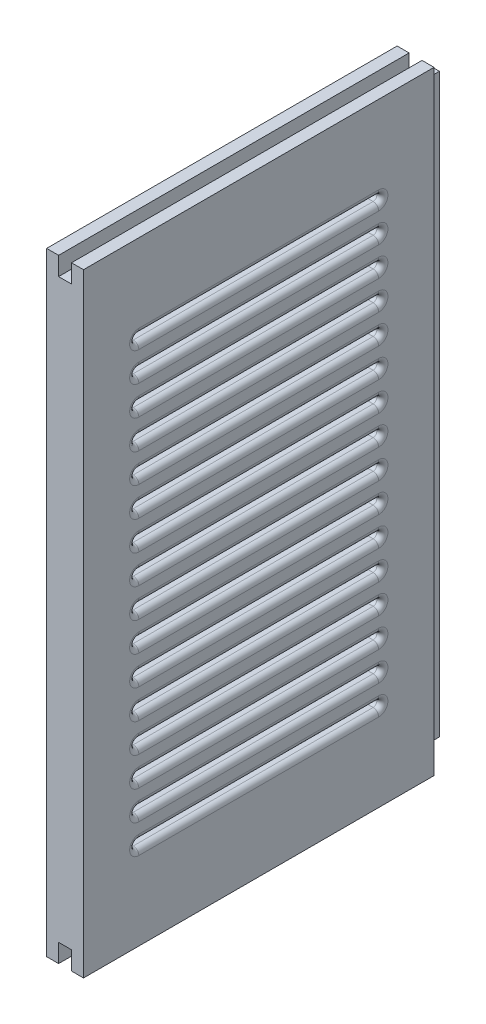
from build123d import *
from OCP.BRepFilletAPI import BRepFilletAPI_MakeChamfer

# Parameters (mm, degrees)
SKETCH1_W              = 166.25
SKETCH1_H              = 95
BOSS_EXTRUDE1_DEPTH    = 10
SKETCH2_W              = 3.3
SKETCH2_H              = 4.8
BOSS_EXTRUDE2_DEPTH    = 166.25
SKETCH3_W              = 3.5
SKETCH3_H              = 99.8
CUT_EXTRUDE1_DEPTH     = 5
SKETCH4_W              = 146.25
SKETCH4_H              = 85
CUT_EXTRUDE2_DEPTH     = 5
CHAMFER1_SIZE          = 2.5
CHAMFER1_SIZE_2        = 5
CUT_EXTRUDE3_REACH     = 193.544
FILLET1_R              = 1.5
LPATTERN1_COUNT        = 16
LPATTERN1_PITCH        = 7.916666667
FILLET1_OF_LPATTERN1_R = 1.5


with BuildPart() as part:
    # Sketch1 → Boss-Extrude1 (new body)
    with BuildSketch(Plane.YZ):
        with Locations((83.125, 47.5)):
            Rectangle(SKETCH1_W, SKETCH1_H)
    extrude(amount=-BOSS_EXTRUDE1_DEPTH)

    # Sketch2 → Boss-Extrude2 (add)
    with BuildSketch(Plane(origin=(0, 166.25, 0), x_dir=(-1, 0, 0), z_dir=(0, 1, 0))):
        with Locations((5, -2.4)):
            Rectangle(SKETCH2_W, SKETCH2_H)
    extrude(amount=-BOSS_EXTRUDE2_DEPTH)

    # Sketch3 → Cut-Extrude1 (cut)
    with BuildSketch(Plane(origin=(0, 166.25, 0), x_dir=(-1, 0, 0), z_dir=(0, 1, 0))):
        with Locations((5, 45.1)):
            Rectangle(SKETCH3_W, SKETCH3_H)
    cut_extrude1 = extrude(amount=-CUT_EXTRUDE1_DEPTH, mode=Mode.SUBTRACT)

    # Mirror1: Cut-Extrude1 across plane
    add(cut_extrude1.mirror(Plane.ZX.offset(83.125)), mode=Mode.SUBTRACT)

    # Sketch4 → Cut-Extrude2 (cut)
    with BuildSketch(Plane(origin=(-10, 0, 0), x_dir=(0, -1, 0), z_dir=(-1, 0, 0))):
        with Locations((-83.125, 47.5)):
            Rectangle(SKETCH4_W, SKETCH4_H)
    extrude(amount=-CUT_EXTRUDE2_DEPTH, mode=Mode.SUBTRACT)

    # Chamfer1
    chamfer1_edges_1 = [part.edges().sort_by_distance(p)[0] for p in [
        (-10, 10, 47.5),
    ]]
    chamfer1_side_1 = [part.faces().sort_by_distance(p)[0] for p in [
        (-10, 9.95, 47.5),
    ]]
    chamfer1_edges_2 = [part.edges().sort_by_distance(p)[0] for p in [
        (-10, 83.125, 5),
    ]]
    chamfer1_side_2 = [part.faces().sort_by_distance(p)[0] for p in [
        (-10, 83.125, 4.95),
    ]]
    chamfer1_edges_3 = [part.edges().sort_by_distance(p)[0] for p in [
        (-10, 156.25, 47.5),
    ]]
    chamfer1_side_3 = [part.faces().sort_by_distance(p)[0] for p in [
        (-10, 156.3, 47.5),
    ]]
    chamfer1_edges_4 = [part.edges().sort_by_distance(p)[0] for p in [
        (-10, 83.125, 90),
    ]]
    chamfer1_side_4 = [part.faces().sort_by_distance(p)[0] for p in [
        (-10, 83.125, 90.05),
    ]]
    chamfer1 = BRepFilletAPI_MakeChamfer(part.part.solid().wrapped)
    for e in chamfer1_edges_1:
        chamfer1.Add(CHAMFER1_SIZE - 0.0001, CHAMFER1_SIZE_2 - 0.0001, e.wrapped, chamfer1_side_1[0].wrapped)
    for e in chamfer1_edges_2:
        chamfer1.Add(CHAMFER1_SIZE - 0.0001, CHAMFER1_SIZE_2 - 0.0001, e.wrapped, chamfer1_side_2[0].wrapped)
    for e in chamfer1_edges_3:
        chamfer1.Add(CHAMFER1_SIZE - 0.0001, CHAMFER1_SIZE_2 - 0.0001, e.wrapped, chamfer1_side_3[0].wrapped)
    for e in chamfer1_edges_4:
        chamfer1.Add(CHAMFER1_SIZE - 0.0001, CHAMFER1_SIZE_2 - 0.0001, e.wrapped, chamfer1_side_4[0].wrapped)
    add(Compound.cast(chamfer1.Shape()), mode=Mode.REPLACE)  # a hair under: the kernel refuses the full size

    # Sketch5 → Cut-Extrude3 (cut, up to next)
    with BuildSketch(Plane(origin=(-5, 0, 0), x_dir=(0, -1, 0), z_dir=(-1, 0, 0)), mode=Mode.PRIVATE) as cut_extrude3_sk1:
        with BuildLine():
            Line((-141.5, 80), (-141.5, 15))
            ThreePointArc((-141.5, 15), (-142.5, 14), (-143.5, 15))
            Line((-143.5, 15), (-143.5, 80))
            ThreePointArc((-143.5, 80), (-142.5, 81), (-141.5, 80))
        make_face()
    cut_extrude3_tool1 = extrude(cut_extrude3_sk1.sketch, amount=-CUT_EXTRUDE3_REACH, mode=Mode.PRIVATE) & part.part
    cut_extrude3 = cut_extrude3_tool1.solids().sort_by_distance((-5, 142.5, 47.5))[0]
    add(cut_extrude3, mode=Mode.SUBTRACT)

    # Fillet1
    fillet1_edges = [part.edges().sort_by_distance(p)[0] for p in [
        (-5, 142.5, 81),
        (-5, 143.5, 47.5),
        (-5, 142.5, 14),
        (-5, 141.5, 47.5),
        (0, 143.5, 47.5),
        (0, 142.5, 81),
        (0, 141.5, 47.5),
        (0, 142.5, 14),
    ]]
    fillet(fillet1_edges, radius=FILLET1_R)

    # LPattern1: Cut-Extrude3 ×16
    with Locations(*[(0, -i * LPATTERN1_PITCH, 0) for i in range(1, LPATTERN1_COUNT)]):
        add(cut_extrude3, mode=Mode.SUBTRACT)

    # Fillet1 of LPattern1
    fillet1_of_lpattern1_edges = [part.edges().sort_by_distance(p)[0] for p in [
        (-5, 134.583333333, 81),
        (-5, 135.583333333, 47.5),
        (-5, 134.583333333, 14),
        (-5, 133.583333333, 47.5),
        (0, 135.583333333, 47.5),
        (0, 134.583333333, 81),
        (0, 133.583333333, 47.5),
        (0, 134.583333333, 14),
        (-5, 126.666666667, 81),
        (-5, 127.666666667, 47.5),
        (-5, 126.666666667, 14),
        (-5, 125.666666667, 47.5),
        (0, 127.666666667, 47.5),
        (0, 126.666666667, 81),
        (0, 125.666666667, 47.5),
        (0, 126.666666667, 14),
        (-5, 118.75, 81),
        (-5, 119.75, 47.5),
        (-5, 118.75, 14),
        (-5, 117.75, 47.5),
        (0, 119.75, 47.5),
        (0, 118.75, 81),
        (0, 117.75, 47.5),
        (0, 118.75, 14),
        (-5, 110.833333333, 81),
        (-5, 111.833333333, 47.5),
        (-5, 110.833333333, 14),
        (-5, 109.833333333, 47.5),
        (0, 111.833333333, 47.5),
        (0, 110.833333333, 81),
        (0, 109.833333333, 47.5),
        (0, 110.833333333, 14),
        (-5, 102.916666667, 81),
        (-5, 103.916666667, 47.5),
        (-5, 102.916666667, 14),
        (-5, 101.916666667, 47.5),
        (0, 103.916666667, 47.5),
        (0, 102.916666667, 81),
        (0, 101.916666667, 47.5),
        (0, 102.916666667, 14),
        (-5, 95, 81),
        (-5, 96, 47.5),
        (-5, 95, 14),
        (-5, 94, 47.5),
        (0, 96, 47.5),
        (0, 95, 81),
        (0, 94, 47.5),
        (0, 95, 14),
        (-5, 87.083333333, 81),
        (-5, 88.083333333, 47.5),
        (-5, 87.083333333, 14),
        (-5, 86.083333333, 47.5),
        (0, 88.083333333, 47.5),
        (0, 87.083333333, 81),
        (0, 86.083333333, 47.5),
        (0, 87.083333333, 14),
        (-5, 79.166666667, 81),
        (-5, 80.166666667, 47.5),
        (-5, 79.166666667, 14),
        (-5, 78.166666667, 47.5),
        (0, 80.166666667, 47.5),
        (0, 79.166666667, 81),
        (0, 78.166666667, 47.5),
        (0, 79.166666667, 14),
        (-5, 71.25, 81),
        (-5, 72.25, 47.5),
        (-5, 71.25, 14),
        (-5, 70.25, 47.5),
        (0, 72.25, 47.5),
        (0, 71.25, 81),
        (0, 70.25, 47.5),
        (0, 71.25, 14),
        (-5, 63.333333333, 81),
        (-5, 64.333333333, 47.5),
        (-5, 63.333333333, 14),
        (-5, 62.333333333, 47.5),
        (0, 64.333333333, 47.5),
        (0, 63.333333333, 81),
        (0, 62.333333333, 47.5),
        (0, 63.333333333, 14),
        (-5, 55.416666667, 81),
        (-5, 56.416666667, 47.5),
        (-5, 55.416666667, 14),
        (-5, 54.416666667, 47.5),
        (0, 56.416666667, 47.5),
        (0, 55.416666667, 81),
        (0, 54.416666667, 47.5),
        (0, 55.416666667, 14),
        (-5, 47.5, 81),
        (-5, 48.5, 47.5),
        (-5, 47.5, 14),
        (-5, 46.5, 47.5),
        (0, 48.5, 47.5),
        (0, 47.5, 81),
        (0, 46.5, 47.5),
        (0, 47.5, 14),
        (-5, 39.583333333, 81),
        (-5, 40.583333333, 47.5),
        (-5, 39.583333333, 14),
        (-5, 38.583333333, 47.5),
        (0, 40.583333333, 47.5),
        (0, 39.583333333, 81),
        (0, 38.583333333, 47.5),
        (0, 39.583333333, 14),
        (-5, 31.666666667, 81),
        (-5, 32.666666667, 47.5),
        (-5, 31.666666667, 14),
        (-5, 30.666666667, 47.5),
        (0, 32.666666667, 47.5),
        (0, 31.666666667, 81),
        (0, 30.666666667, 47.5),
        (0, 31.666666667, 14),
        (-5, 23.75, 81),
        (-5, 24.75, 47.5),
        (-5, 23.75, 14),
        (-5, 22.75, 47.5),
        (0, 24.75, 47.5),
        (0, 23.75, 81),
        (0, 22.75, 47.5),
        (0, 23.75, 14),
    ]]
    fillet(fillet1_of_lpattern1_edges, radius=FILLET1_OF_LPATTERN1_R)


solid = part.part
